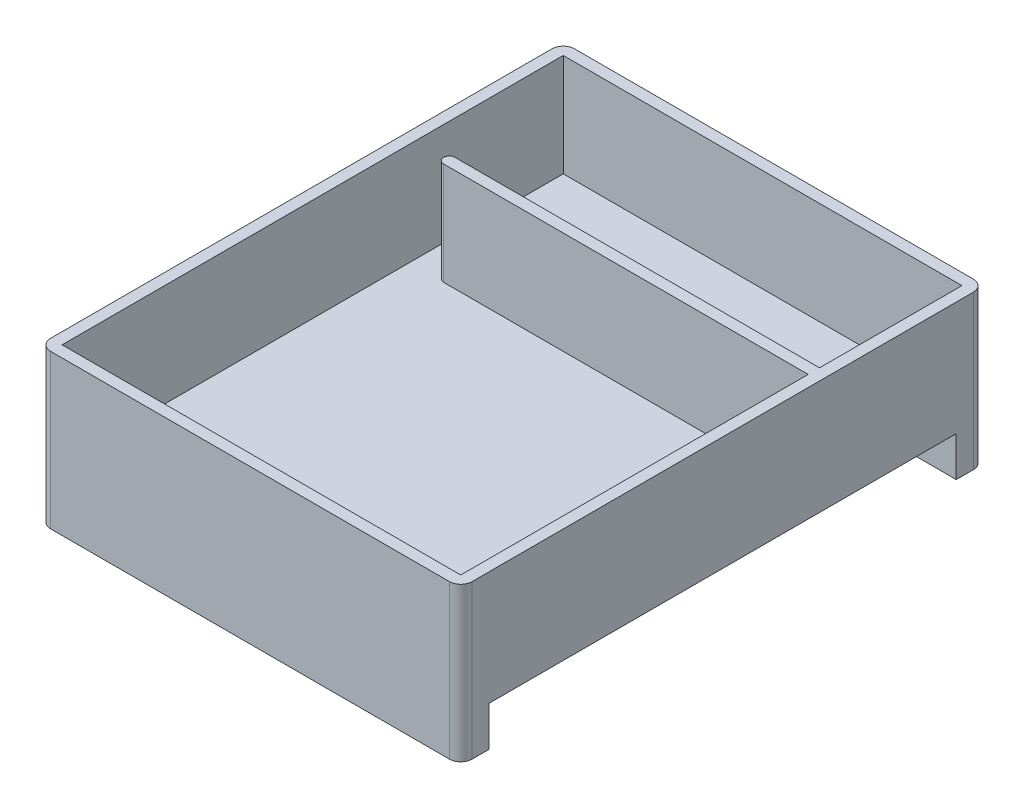
from build123d import *

# Parameters (mm, degrees)
SKETCH_1_W          = 74
SKETCH_1_H          = 65
EXTRUDE_1_DEPTH     = 20
SKETCH_2_W          = 70
SKETCH_2_H          = 61
CUT_EXTRUDE_1_DEPTH = 18
SKETCH_3_W          = 5
SKETCH_3_H          = 2
CUT_EXTRUDE_2_DEPTH = 18
SKETCH_4_W          = 74
SKETCH_4_H          = 27
EXTRUDE_2_DEPTH     = 20
CUT_EXTRUDE_3_DEPTH = 18
SKETCH_6_W          = 74
SKETCH_6_H          = 5
EXTRUDE_3_DEPTH     = 7
FILLET_1_R          = 2
FILLET_2_R          = 2
FILLET_3_R          = 2
FILLET_5_R          = 1


with BuildPart() as part:
    # 草图1 → 凸台-拉伸1 (new body)
    with BuildSketch(Plane(origin=(0, 0, 0), x_dir=(1, 0, 0), z_dir=(0, 1, 0))):
        with Locations((37, 32.5)):
            Rectangle(SKETCH_1_W, SKETCH_1_H)
    extrude(amount=EXTRUDE_1_DEPTH)

    # 草图2 → 切除-拉伸1 (cut)
    with BuildSketch(Plane(origin=(0, 20, 0), x_dir=(1, 0, 0), z_dir=(0, 1, 0))):
        with Locations((37, 32.5)):
            Rectangle(SKETCH_2_W, SKETCH_2_H)
    extrude(amount=-CUT_EXTRUDE_1_DEPTH, mode=Mode.SUBTRACT)

    # 草图3 → 切除-拉伸2 (cut)
    with BuildSketch(Plane(origin=(0, 20, 0), x_dir=(1, 0, 0), z_dir=(0, 1, 0))):
        with Locations((4.5, 64)):
            Rectangle(SKETCH_3_W, SKETCH_3_H)
    extrude(amount=-CUT_EXTRUDE_2_DEPTH, mode=Mode.SUBTRACT)

    # 草图4 → 凸台-拉伸2 (add)
    with BuildSketch(Plane.XZ):
        with Locations((37, -78.5)):
            Rectangle(SKETCH_4_W, SKETCH_4_H)
    extrude(amount=-EXTRUDE_2_DEPTH)

    # 草图5 → 切除-拉伸3 (cut)
    with BuildSketch(Plane(origin=(0, 20, 0), x_dir=(1, 0, 0), z_dir=(0, 1, 0))):
        Polygon((2, 65), (7, 65), (72, 65), (72, 90), (2, 90), align=None)
    extrude(amount=-CUT_EXTRUDE_3_DEPTH, mode=Mode.SUBTRACT)

    # 草图6 → 凸台-拉伸3 (add)
    with BuildSketch(Plane.XZ):
        with Locations((37, -2.5)):
            Rectangle(SKETCH_6_W, SKETCH_6_H)
        with Locations((37, -89.5)):
            Rectangle(SKETCH_6_W, SKETCH_6_H)
    extrude(amount=EXTRUDE_3_DEPTH)

    # 圆角1
    fillet_1_edges = [part.edges().sort_by_distance(p)[0] for p in [
        (0, 6.5, 0),
    ]]
    fillet(fillet_1_edges, radius=FILLET_1_R)

    # 圆角2
    fillet_2_edges = [part.edges().sort_by_distance(p)[0] for p in [
        (74, 6.5, 0),
    ]]
    fillet(fillet_2_edges, radius=FILLET_2_R)

    # 圆角3
    fillet_3_edges = [part.edges().sort_by_distance(p)[0] for p in [
        (0, 6.5, -92),
        (74, 6.5, -92),
    ]]
    fillet(fillet_3_edges, radius=FILLET_3_R)

    # 圆角5
    fillet_5_edges = [part.edges().sort_by_distance(p)[0] for p in [
        (7, 11, -65),
        (7, 11, -63),
    ]]
    fillet(fillet_5_edges, radius=FILLET_5_R - 0.0001)  # a hair under: the kernel refuses the full size


solid = part.part
